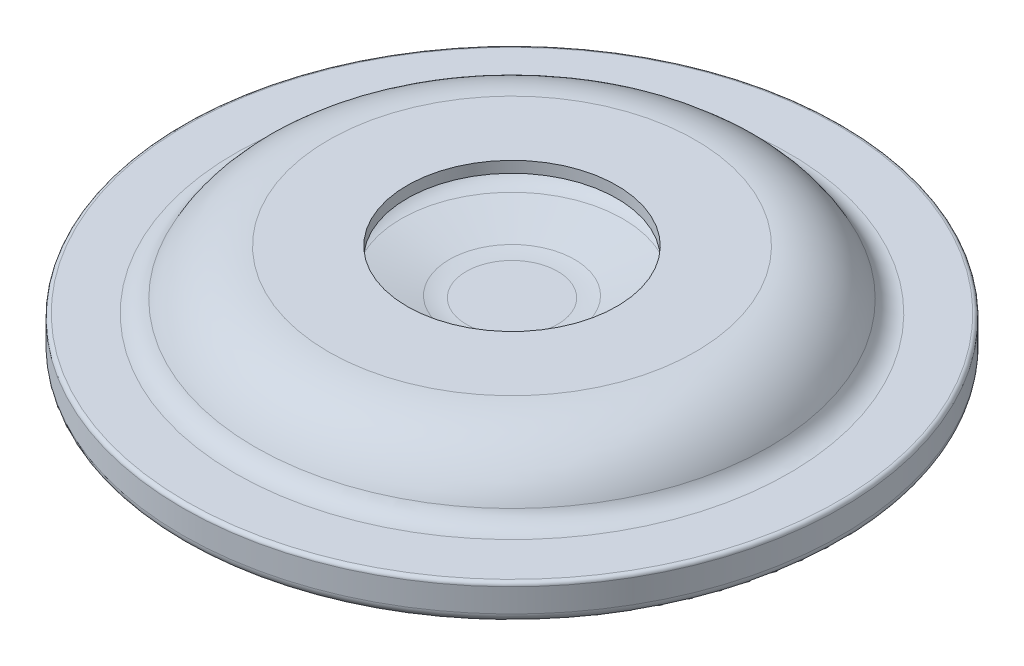
from build123d import *


with BuildPart() as part:
    # Sketch2 → Revolve1 (revolve)
    with BuildSketch(Plane.XY):
        with BuildLine():
            Line((14, 6), (24.5, 6))
            ThreePointArc((24.5, 6), (30.273662603, 4.345259334), (34.294313408, -0.116546763))
            ThreePointArc((34.294313408, -0.116546763), (35.400914546, -1.344566789), (36.989995997, -1.8))
            Line((36.989995997, -1.8), (43.5, -1.8))
            ThreePointArc((43.5, -1.8), (43.853553391, -1.946446609), (44, -2.3))
            Line((44, -2.3), (44, -5.45))
            ThreePointArc((44, -5.45), (43.633883476, -6.333883476), (42.75, -6.7))
            Line((42.75, -6.7), (39.5, -6.7))
            ThreePointArc((39.5, -6.7), (39.146446609, -6.553553391), (39, -6.2))
            Line((39, -6.2), (39, -4.55))
            ThreePointArc((39, -4.55), (38.633883476, -3.666116524), (37.75, -3.3))
            Line((37.75, -3.3), (36.734260384, -3.3))
            ThreePointArc((36.734260384, -3.3), (34.451305009, -2.677900818), (32.799560599, -0.983606557))
            ThreePointArc((32.799560599, -0.983606557), (29.724499147, 2.492710195), (25.470554826, 4.34871095))
            ThreePointArc((25.470554826, 4.34871095), (23.644751392, 4.5), (21.830519473, 4.245031179))
            ThreePointArc((21.830519473, 4.245031179), (19.305043293, 3.202969901), (17.167825042, 1.501141534))
            ThreePointArc((17.167825042, 1.501141534), (16.603606619, 0.982524408), (15.972777881, 0.54736782))
            ThreePointArc((15.972777881, 0.54736782), (14.314974247, -0.250297085), (12.545438053, -0.753609959))
            Line((12.545438053, -0.753609959), (9.561233692, -1.331990739))
            ThreePointArc((9.561233692, -1.331990739), (4.802601657, -2.019971185), (0, -2.25))
            Line((0, -2.25), (0, 0))
            Line((0, 0), (6.110643917, 0))
            ThreePointArc((6.110643917, 0), (7.242676055, 0.064281443), (8.36015446, 0.256299352))
            Line((8.36015446, 0.256299352), (14.800032714, 1.743062396))
            ThreePointArc((14.800032714, 1.743062396), (15.788233421, 2.169324212), (16.562410224, 2.916913705))
            ThreePointArc((16.562410224, 2.916913705), (16.639687107, 3.956570753), (15.75, 4.5))
            Line((15.75, 4.5), (14, 4.5))
            Line((14, 4.5), (14, 6))
        make_face()
    revolve(axis=Axis((0, 0, 0), (0, -1, 0)))


solid = part.part
